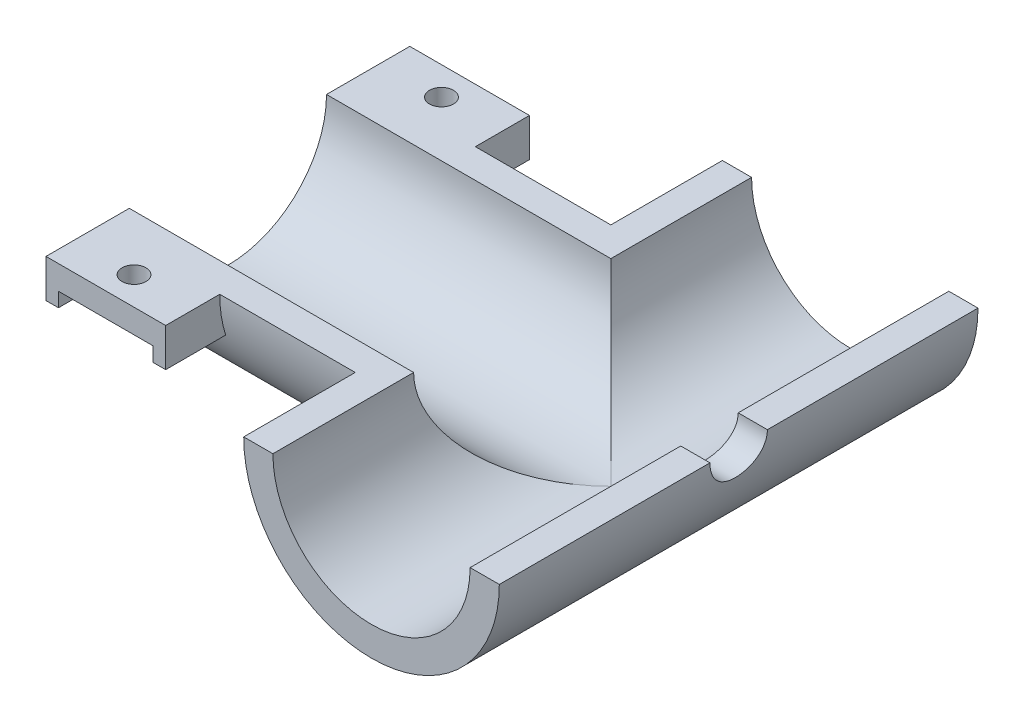
from build123d import *

# Parameters (mm, degrees)
SKETCH1_R                = 16.9545
BOSS_EXTRUDE1_DEPTH      = 50.8
SKETCH2_R                = 16.9545
BOSS_EXTRUDE2_DEPTH      = 31.75
SKETCH3_R                = 13.081
CUT_EXTRUDE1_DEPTH       = 50.8
SKETCH5_R                = 13.081
CUT_EXTRUDE2_DEPTH       = 63.5
CUT_EXTRUDE4_DEPTH       = 77.72150833
CUT_EXTRUDE4_DEPTH_BACK  = 77.72150833
SKETCH6_R                = 3.81
BOSS_EXTRUDE3_REACH      = 91.447
BOSS_EXTRUDE3_END_RADIUS = 16.9545
SKETCH8_W                = 15.875
SKETCH8_H                = 5.08
CUT_EXTRUDE5_REACH       = 91.447
CUT_EXTRUDE5_END_RADIUS  = 16.9545
SKETCH9_W                = 12.573
SKETCH9_H                = 1.905
SKETCH10_R               = 1.5875
CUT_EXTRUDE6_DEPTH       = 77.08291144


with BuildPart() as part:
    # Sketch1 → Boss-Extrude1 (new body)
    with BuildSketch(Plane(origin=(0, 0, 0), x_dir=(0, 0, -1), z_dir=(1, 0, 0))):
        Circle(SKETCH1_R)
    extrude(amount=BOSS_EXTRUDE1_DEPTH)

    # Sketch2 → Boss-Extrude2 (add, symmetric)
    with BuildSketch(Plane.XY):
        with Locations((50.8, 0)):
            Circle(SKETCH2_R)
    extrude(amount=BOSS_EXTRUDE2_DEPTH, both=True)

    # Sketch3 → Cut-Extrude1 (cut)
    with BuildSketch(Plane.ZY):
        Circle(SKETCH3_R)
    extrude(amount=-CUT_EXTRUDE1_DEPTH, mode=Mode.SUBTRACT)

    # Sketch5 → Cut-Extrude2 (cut)
    with BuildSketch(Plane(origin=(0, 0, -31.75), x_dir=(-1, 0, 0), z_dir=(0, 0, -1))):
        with Locations((-50.8, 0)):
            Circle(SKETCH5_R)
    extrude(amount=-CUT_EXTRUDE2_DEPTH, mode=Mode.SUBTRACT)

    # Sketch6 → Cut-Extrude4 (cut, two sides: drawn at the far end of the back side and taken through both)
    with BuildSketch(Plane(origin=(0, 0, 0), x_dir=(0, 0, -1), z_dir=(1, 0, 0)).offset(-CUT_EXTRUDE4_DEPTH_BACK)):
        with Locations(Location((0, 0, 0), (0, 0, 180))):
            Circle(SKETCH6_R)
    extrude(amount=CUT_EXTRUDE4_DEPTH + CUT_EXTRUDE4_DEPTH_BACK, mode=Mode.SUBTRACT)

    # SurfaceCut1
    split(bisect_by=Plane(origin=(0, 0, 0), x_dir=(1, 0, 0), z_dir=(0, 1, 0)), keep=Keep.BOTTOM)


with BuildPart() as body_2:
    # Boss-Extrude3: up to this cylinder (the profile starts outside it)
    boss_extrude3_end = Plane(origin=(7.9375, 0, 0), z_dir=(-1, 0, 0)) * Cylinder(BOSS_EXTRUDE3_END_RADIUS, 217.803, mode=Mode.PRIVATE)
    # Sketch8 → Boss-Extrude3 (new, up to the surface)
    with BuildSketch(Plane.XY.offset(24.13), mode=Mode.PRIVATE) as boss_extrude3_sk1:
        with Locations((7.9375, -2.54)):
            Rectangle(SKETCH8_W, SKETCH8_H)
    boss_extrude3_tool1 = extrude(boss_extrude3_sk1.sketch, amount=-BOSS_EXTRUDE3_REACH, mode=Mode.PRIVATE) - boss_extrude3_end
    add(boss_extrude3_tool1.solids().sort_by_distance((7.9375, -2.54, 24.13))[0])

    # Cut-Extrude5: up to this cylinder (the profile starts outside it)
    cut_extrude5_end = Plane(origin=(7.9375, 0, 0), z_dir=(-1, 0, 0)) * Cylinder(CUT_EXTRUDE5_END_RADIUS, 217.803, mode=Mode.PRIVATE)
    # Sketch9 → Cut-Extrude5 (cut, up to the surface)
    with BuildSketch(Plane.XY.offset(24.13), mode=Mode.PRIVATE) as cut_extrude5_sk1:
        with Locations((7.9375, -4.1275)):
            Rectangle(SKETCH9_W, SKETCH9_H)
    cut_extrude5_tool1 = extrude(cut_extrude5_sk1.sketch, amount=-CUT_EXTRUDE5_REACH, mode=Mode.PRIVATE) - cut_extrude5_end
    add(cut_extrude5_tool1.solids().sort_by_distance((7.9375, -4.1275, 24.13))[0], mode=Mode.SUBTRACT)


with BuildPart() as body_3:
    # Mirror1: mirrored copy
    add(body_2.part.mirror(Plane.XY))


with BuildPart() as part_1:
    add(part.part)

    # Intersect1: read off the stored shape, not the designer's step
    # Intersect1: union body 3, body 2
    add(body_3.part)
    add(body_2.part)

    # Sketch10 → Cut-Extrude6 (cut, through all)
    with BuildSketch(Plane.XZ.offset(3.175)):
        with Locations(Location((7.9375, 20.392281148, 0), (0, 0, 270))):
            Circle(SKETCH10_R)
    cut_extrude6 = extrude(amount=-CUT_EXTRUDE6_DEPTH, mode=Mode.SUBTRACT)

    # Mirror2: Cut-Extrude6 across plane
    add(cut_extrude6.mirror(Plane.XY), mode=Mode.SUBTRACT)


solid = part_1.part
